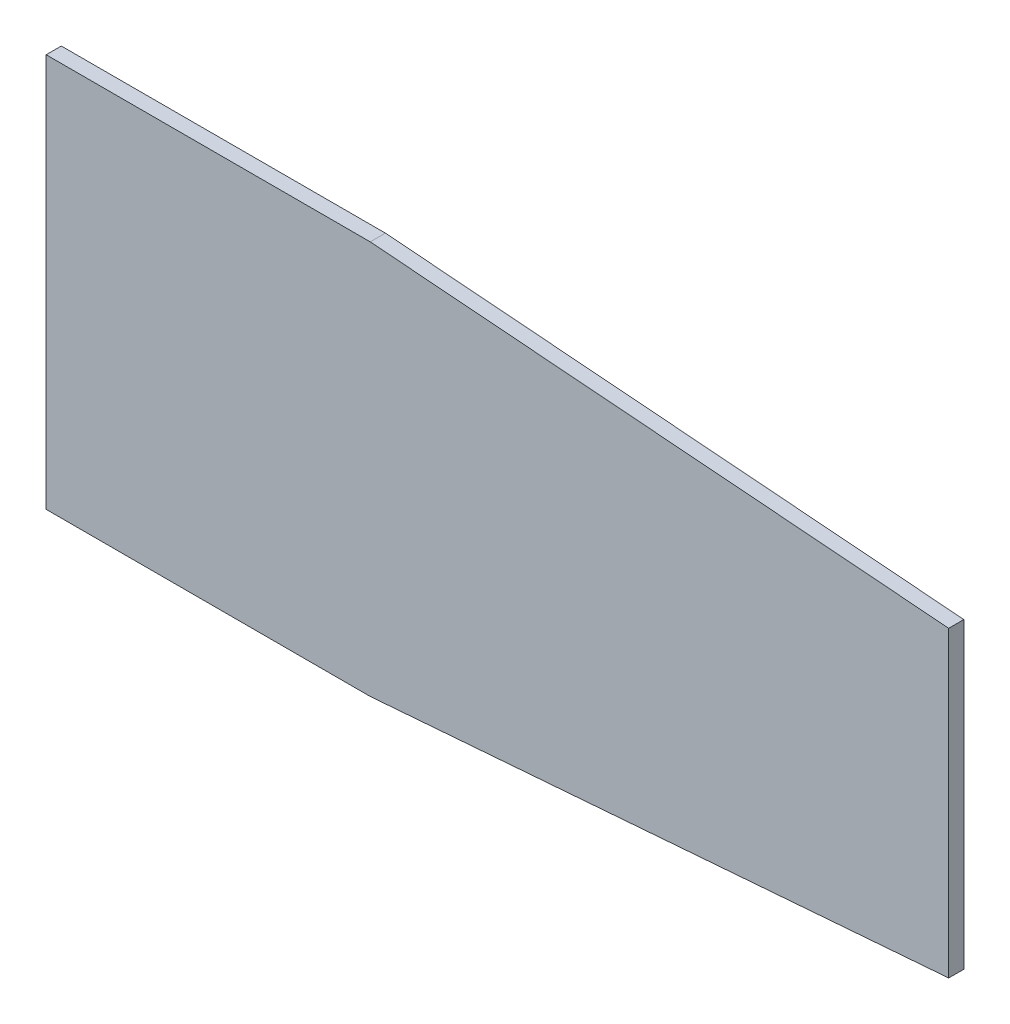
from build123d import *

# Parameters (mm, degrees)
GRUNDPLATTE_DEPTH = 5


with BuildPart() as part:
    # Skizze1 → Grundplatte (new body)
    with BuildSketch(Plane.XY):
        Polygon((0, -65), (0, 65), (107, 65), (298, 50), (298, -50), (107, -65), align=None)
    extrude(amount=GRUNDPLATTE_DEPTH)


solid = part.part
